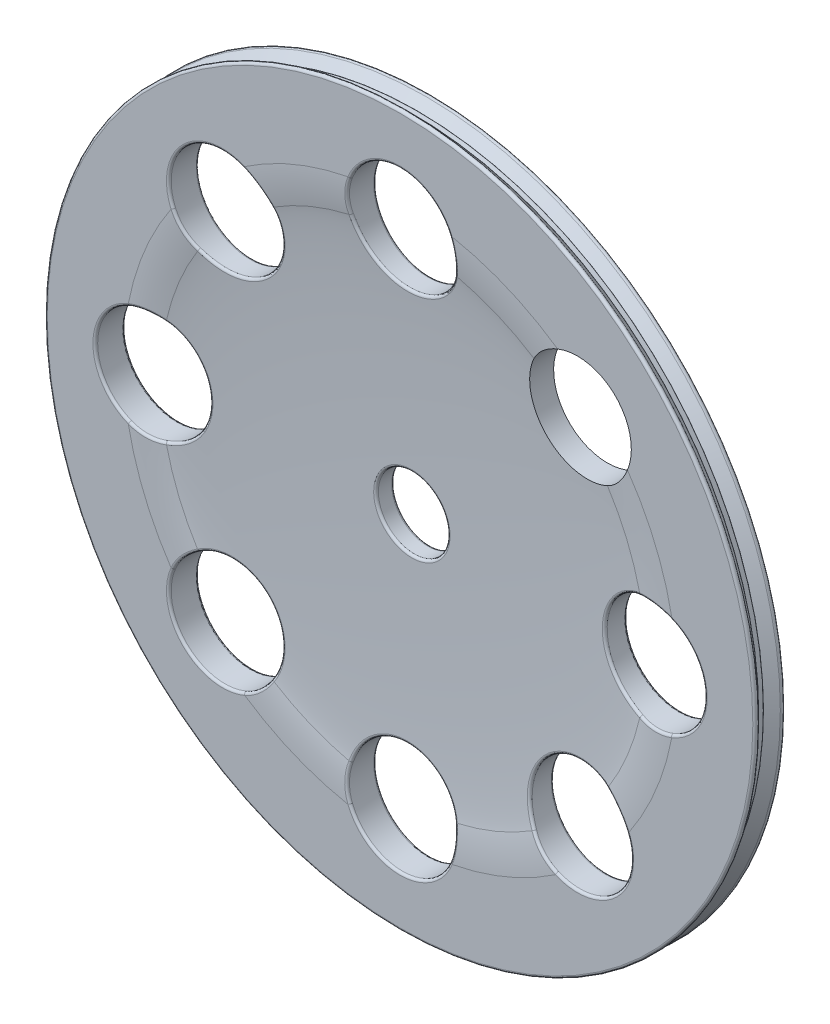
from build123d import *

# Parameters (mm, degrees)
SKETCH1_R               = 15
BOSS_EXTRUDE1_DEPTH     = 0.625
FILLET1_R               = 8
CUT_EXTRUDE3_DEPTH      = 22.222408702
CUT_EXTRUDE3_DEPTH_BACK = 22.222408702
SKETCH5_R               = 2.25
FILLET2_R               = 0.1
CUT_EXTRUDE4_DEPTH      = 22.022496276
CUT_EXTRUDE4_DEPTH_BACK = 22.022496276
SKETCH7_R               = 1.5
FILLET3_R               = 0.1
FILLET4_R               = 0.01


# Read off the part's stored shape, not the designer's step: Dome1
with BuildPart() as part:
    # Sketch1 → Boss-Extrude1 (new, symmetric)
    with BuildSketch(Plane.XY):
        Circle(SKETCH1_R)
    extrude(amount=BOSS_EXTRUDE1_DEPTH, both=True)

    # Dome1 outline → Dome1 (revolve, cut)
    with BuildSketch(Plane.XZ):
        with BuildLine():
            Line((0, 0.6250001), (0, 0.125))
            add(Edge.make_bspline(
                [(0, 0.125), (10.5, 0.125), (10.5, 0.625)],
                knots=[4.71238898, 4.71238898, 4.71238898, 6.283185307, 6.283185307, 6.283185307], degree=2, weights=[1, 0.707106781, 1]))
            Line((10.5, 0.625), (0, 0.6250001))
        make_face()
    revolve(axis=Axis((0, 0, 0), (0, 0, 1)), mode=Mode.SUBTRACT)

    # Fillet1
    fillet1_edges = [part.edges().sort_by_distance(p)[0] for p in [
        (-10.5, 0, 0.625),
    ]]
    fillet(fillet1_edges, radius=FILLET1_R)

    # Sketch5 → Cut-Extrude3 (cut, two sides: drawn at the far end of the back side and taken through both)
    with BuildSketch(Plane.XY.offset(-CUT_EXTRUDE3_DEPTH_BACK)):
        with Locations(Location((10.5, 0, 0), (0, 0, 180))):
            Circle(SKETCH5_R)
        with Locations(Location((7.424621202, -7.424621202, 0), (0, 0, 210.005605381))):
            Circle(SKETCH5_R)
        with Locations(Location((0, -10.5, 0), (0, 0, 165.005605162))):
            Circle(SKETCH5_R)
        with Locations(Location((-7.424621202, -7.424621202, 0), (0, 0, 158.285949057))):
            Circle(SKETCH5_R)
        with Locations(Location((-10.5, 0, 0), (0, 0, 113.285949057))):
            Circle(SKETCH5_R)
        with Locations(Location((-7.424621202, 7.424621202, 0), (0, 0, 201.714050943))):
            Circle(SKETCH5_R)
        with Locations(Location((0, 10.5, 0), (0, 0, 194.994394657))):
            Circle(SKETCH5_R)
        with Locations(Location((7.424621202, 7.424621202, 0), (0, 0, 149.994394657))):
            Circle(SKETCH5_R)
    extrude(amount=CUT_EXTRUDE3_DEPTH + CUT_EXTRUDE3_DEPTH_BACK, mode=Mode.SUBTRACT)

    # Sketch6 → Cut-Revolve2 (revolve, cut)
    with BuildSketch(Plane(origin=(0, 0, 0), x_dir=(1, 0, 0), z_dir=(0, 1, 0))):
        Polygon((15, 0.625), (14.475, 0.1), (14.475, -0.1), (15, -0.625), align=None)
    revolve(axis=Axis((0, 0, -0.625), (0, 0, 1)), mode=Mode.SUBTRACT)

    # Fillet2
    fillet2_edges = [part.edges().sort_by_distance(p)[0] for p in [
        (10.659691286, -2.244325893, 0.595870995),
        (10.659691286, 2.244325893, 0.595870995),
        (5.95056446, -9.124520241, 0.595871081),
        (9.12452294, -5.950567571, 0.59587102),
        (-2.244325591, -10.659695542, 0.595871061),
        (2.24432541, -10.659698085, 0.595871033),
        (-9.124521539, -5.950565957, 0.59587098),
        (-5.950565438, -9.12452109, 0.595871027),
        (-10.659693199, 2.244325757, 0.595871009),
        (-10.659693199, -2.244325757, 0.595871009),
        (-5.950565438, 9.12452109, 0.595871027),
        (-9.124521539, 5.950565957, 0.59587098),
        (2.24432541, 10.659698085, 0.595871033),
        (-2.24432559, 10.659695546, 0.595871061),
        (8.03e-07, 8.250000001, 0.315705213),
        (2.17339007, 11.082130228, -0.625),
        (-1.677e-06, 12.75, 0.625),
        (-5.833630945, 5.833630945, 0.315705213),
        (-5.334276998, 8.257064057, -0.625),
        (-9.015611392, 9.015611529, 0.625),
        (-8.250000001, 0, 0.315705213),
        (-9.610529426, -2.06672255, -0.625),
        (-12.75, -1.74e-06, 0.625),
        (-5.833630945, -5.833630945, 0.315705213),
        (-5.334276998, -8.257064057, -0.625),
        (-9.015611392, -9.015611529, 0.625),
        (8.06e-07, -8.250000001, 0.315705213),
        (2.173390068, -11.082130235, -0.625),
        (-1.677e-06, -12.75, 0.625),
        (5.833631512, -5.833630378, 0.315705213),
        (9.37306829, -6.299430576, -0.625),
        (9.015609453, -9.015613467, 0.625),
        (8.717187973, -1.372618418, 0.35404574),
        (12.75, 0, -0.625),
        (12.75, 0, 0.625),
        (-15, 0, -0.625),
        (-15, 0, 0.625),
    ]]
    fillet(fillet2_edges, radius=FILLET2_R)

    # Sketch7 → Cut-Extrude4 (cut, two sides: drawn at the far end of the back side and taken through both)
    with BuildSketch(Plane.XY.offset(-CUT_EXTRUDE4_DEPTH_BACK)):
        Circle(SKETCH7_R)
    extrude(amount=CUT_EXTRUDE4_DEPTH + CUT_EXTRUDE4_DEPTH_BACK, mode=Mode.SUBTRACT)

    # Fillet3
    fillet3_edges = [part.edges().sort_by_distance(p)[0] for p in [
        (-1.499999999, 3e-09, 0.130128341),
        (-1.5, 0, -0.625),
    ]]
    fillet(fillet3_edges, radius=FILLET3_R)

    # Fillet4
    fillet4_edges = [part.edges().sort_by_distance(p)[0] for p in [
        (-14.475, 0, -0.1),
        (-14.475, 0, 0.1),
    ]]
    fillet(fillet4_edges, radius=FILLET4_R)


solid = part.part
